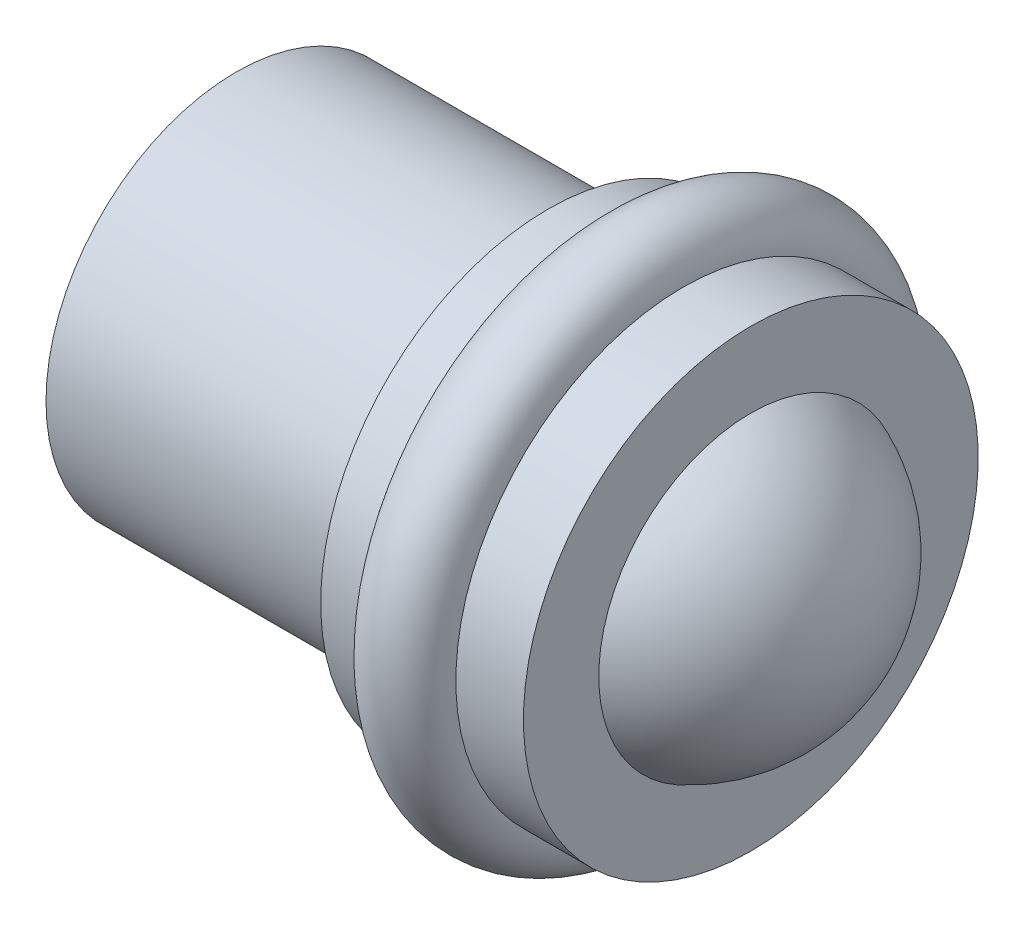
from build123d import *

# Parameters (mm, degrees)
SKETCH2_R = 1.11125


with BuildPart() as part:
    # Sketch1 → Revolve1 (revolve)
    with BuildSketch(Plane.XY):
        with BuildLine():
            Line((-8.1153, 0), (-8.1153, 5.0038))
            Line((-8.1153, 5.0038), (0.0889, 5.0038))
            Line((0.0889, 5.0038), (0.0889, 5.9817))
            Line((0.0889, 5.9817), (1.4224, 5.9817))
            ThreePointArc((1.4224, 5.9817), (2.53365, 4.87045), (3.6449, 5.9817))
            Line((3.6449, 5.9817), (5.4229, 5.9817))
            Line((5.4229, 5.9817), (5.4229, 4.0005))
            ThreePointArc((5.4229, 4.0005), (7.379515264, 2.411069162), (8.1153, 0))
            Line((8.1153, 0), (-8.1153, 0))
        make_face()
    revolve(axis=Axis((-8.1153, 0, 0), (1, 0, 0)))


with BuildPart() as body_2:
    # Sketch2 → Revolve2 (revolve)
    with BuildSketch(Plane.XY):
        with Locations((2.53365, 5.9817)):
            Circle(SKETCH2_R)
    revolve(axis=Axis((-8.1153, 0, 0), (1, 0, 0)))


solid = Compound([part.part, body_2.part])
